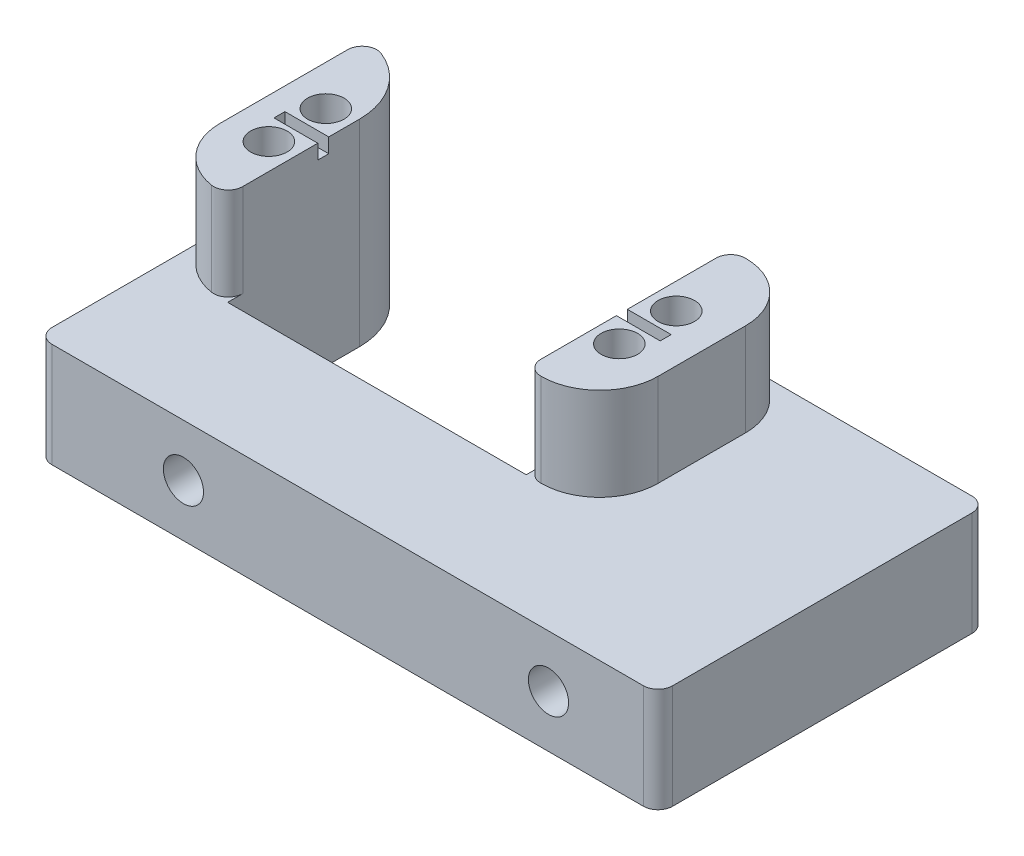
from build123d import *

# Parameters (mm, degrees)
SKETCH1_W           = 85
SKETCH1_H           = 45
BOSS_EXTRUDE1_DEPTH = 27
SKETCH2_R           = 2.5
CUT_EXTRUDE1_DEPTH  = 100.894944817
SKETCH4_W           = 17
SKETCH4_H           = 12.7
CUT_EXTRUDE2_DEPTH  = 100.894944817
SKETCH5_W           = 25
SKETCH5_H           = 12.7
CUT_EXTRUDE3_DEPTH  = 94.477269964
SKETCH6_W           = 40.9
SKETCH6_H           = 28
CUT_EXTRUDE4_DEPTH  = 100.894944817
FILLET1_R           = 10
FILLET2_R           = 8
FILLET4_R           = 2
SKETCH7_R           = 2.75
CUT_EXTRUDE5_DEPTH  = 100.894944817
SKETCH8_W           = 6
SKETCH8_H           = 1.5
CUT_EXTRUDE6_DEPTH  = 2


with BuildPart() as part:
    # Sketch1 → Boss-Extrude1 (new body)
    with BuildSketch(Plane(origin=(0, 0, 0), x_dir=(1, 0, 0), z_dir=(0, 1, 0))):
        with Locations((42.5, 22.5)):
            Rectangle(SKETCH1_W, SKETCH1_H)
    extrude(amount=BOSS_EXTRUDE1_DEPTH)

    # Sketch2 → Cut-Extrude1 (cut, through all)
    with BuildSketch(Plane(origin=(0, 27, 0), x_dir=(1, 0, 0), z_dir=(0, 1, 0))):
        with Locations(Location((5.5, 34, 0), (0, 0, 270))):
            Circle(SKETCH2_R)
        with Locations(Location((53.5, 34, 0), (0, 0, 270))):
            Circle(SKETCH2_R)
        with Locations(Location((53.5, 26.2, 0), (0, 0, 270))):
            Circle(SKETCH2_R)
        with Locations(Location((5.5, 26.2, 0), (0, 0, 270))):
            Circle(SKETCH2_R)
    extrude(amount=-CUT_EXTRUDE1_DEPTH, mode=Mode.SUBTRACT)

    # Sketch4 → Cut-Extrude2 (cut, through all)
    with BuildSketch(Plane.ZY):
        with Locations((-8.5, 20.65)):
            Rectangle(SKETCH4_W, SKETCH4_H)
    extrude(amount=-CUT_EXTRUDE2_DEPTH, mode=Mode.SUBTRACT)

    # Sketch5 → Cut-Extrude3 (cut, through all)
    with BuildSketch(Plane.XY.offset(-17)):
        with Locations((72.5, 20.65)):
            Rectangle(SKETCH5_W, SKETCH5_H)
    extrude(amount=-CUT_EXTRUDE3_DEPTH, mode=Mode.SUBTRACT)

    # Sketch6 → Cut-Extrude4 (cut, through all)
    with BuildSketch(Plane(origin=(0, 27, 0), x_dir=(1, 0, 0), z_dir=(0, 1, 0))):
        with Locations((29.5, 31)):
            Rectangle(SKETCH6_W, SKETCH6_H)
    extrude(amount=-CUT_EXTRUDE4_DEPTH, mode=Mode.SUBTRACT)

    # Fillet1
    # the kernel refuses this fillet: 10 mm, written as the material it takes off along each edge
    with BuildSketch(Plane(origin=(9.05, 51.886931812, -45), x_dir=(-1, 0, 0), z_dir=(0, -1, 0))) as fillet1_piece_1:
        with BuildLine():
            CenterArc((10, -9.954772725), FILLET1_R, 95.451319812, 84.548680188)
            Line((0, -9.954772725), (-0.2, -9.954772725))
            Line((-0.2, -9.954772725), (-0.2, 0))
            Line((-0.2, 0), (0, 0.2))
            ThreePointArc((0, 0.2), (4.525, 0.2), (9.031, 0.199095454))
            Line((9.031, 0.199095454), (9.05, 0))
        make_face()
    extrude(amount=76.773863623, mode=Mode.SUBTRACT)

    # Fillet2
    fillet2_edges = [part.edges().sort_by_distance(p)[0] for p in [
        (0, 20.65, -17),
        (60, 20.65, -45),
        (60, 20.65, -17),
    ]]
    fillet(fillet2_edges, radius=FILLET2_R)

    # Fillet4
    # the kernel refuses this fillet: 2 mm, written as the material it takes off along each edge
    with BuildSketch(Plane(origin=(9.05, 32.797158858, -17), x_dir=(0, 0, -1), z_dir=(0, -1, 0))) as fillet4_piece_1:
        with BuildLine():
            CenterArc((2.075685694, -2), FILLET4_R, 90, 99.110170153)
            Line((0.100914258, -2.316666667), (-0.096562885, -2.348333333))
            ThreePointArc((-0.096562885, -2.348333333), (-0.2, -1.05), (-0.2, 0))
            Line((-0.2, 0), (0, 0.2))
            Line((0, 0.2), (2.075685694, 0.2))
            Line((2.075685694, 0.2), (2.075685694, 0))
        make_face()
    extrude(amount=18.497158858, mode=Mode.SUBTRACT)
    with BuildSketch(Plane(origin=(49.95, 32, -17), x_dir=(0, 0, -1), z_dir=(0, -1, 0))) as fillet4_piece_2:
        with BuildLine():
            CenterArc((FILLET4_R, FILLET4_R), FILLET4_R, 180, 90)
            Line((0, FILLET4_R), (0, 0))
            Line((0, 0), (FILLET4_R, 0))
        make_face()
    extrude(amount=17.7, mode=Mode.SUBTRACT)
    with BuildSketch(Plane(origin=(49.95, 32, -45), x_dir=(0, 0, 1), z_dir=(0, -1, 0))) as fillet4_piece_3:
        with BuildLine():
            CenterArc((FILLET4_R, -FILLET4_R), FILLET4_R, 90, 90)
            Line((0, -FILLET4_R), (0, 0))
            Line((0, 0), (FILLET4_R, 0))
        make_face()
    extrude(amount=37, mode=Mode.SUBTRACT)
    with BuildSketch(Plane(origin=(85, -5, -45), x_dir=(0, 0, 1), z_dir=(0, 1, 0)), Plane(origin=(85, -5, 0), x_dir=(-1, 0, 0), z_dir=(0, 1, 0)), Plane(origin=(0, -5, 0), x_dir=(0, 0, -1), z_dir=(0, 1, 0))) as fillet4_piece_4:
        with BuildLine():
            CenterArc((FILLET4_R, -FILLET4_R), FILLET4_R, 90, 90)
            Line((0, -FILLET4_R), (0, 0))
            Line((0, 0), (FILLET4_R, 0))
        make_face()
    extrude(amount=24.3, mode=Mode.SUBTRACT)
    with BuildSketch(Plane(origin=(0, -7.039544043, -45), x_dir=(0.972186544788057, 0, 0.23420786095487744), z_dir=(0, 1, 0))) as fillet4_piece_5:
        with BuildLine():
            CenterArc((2.534235855, -1.980078713), FILLET4_R, 81.906386313, 111.638547186)
            Line((0.589862766, -2.448494435), (0, 0))
            ThreePointArc((0, 0), (1.407908809, 0.099606433), (2.815817617, 0))
        make_face()
    extrude(amount=41.079088086, mode=Mode.SUBTRACT)

    # Sketch7 → Cut-Extrude5 (cut, through all)
    with BuildSketch(Plane.XY):
        with Locations((70, 7.15)):
            Circle(SKETCH7_R)
        with Locations((20, 7.15)):
            Circle(SKETCH7_R)
    extrude(amount=-CUT_EXTRUDE5_DEPTH, mode=Mode.SUBTRACT)

    # Sketch8 → Cut-Extrude6 (cut)
    with BuildSketch(Plane(origin=(0, 27, 0), x_dir=(1, 0, 0), z_dir=(0, 1, 0))):
        with Locations((6.05, 30.1)):
            Rectangle(SKETCH8_W, SKETCH8_H)
        with Locations((52.95, 30.1)):
            Rectangle(SKETCH8_W, SKETCH8_H)
    extrude(amount=-CUT_EXTRUDE6_DEPTH, mode=Mode.SUBTRACT)


solid = part.part
